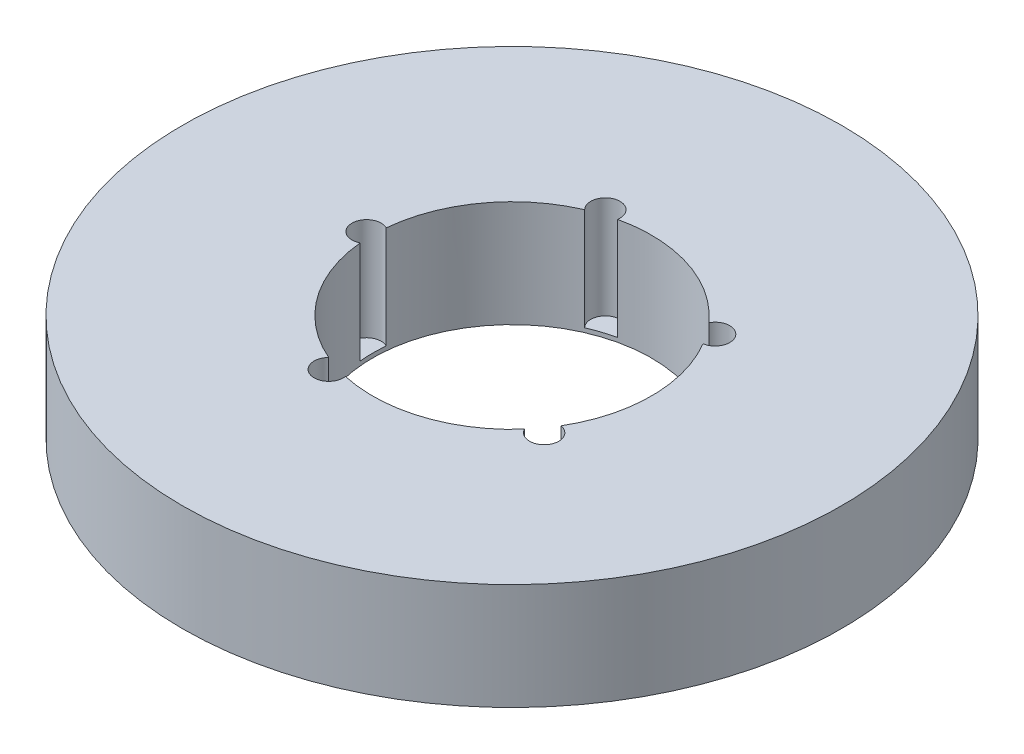
from build123d import *

# Parameters (mm, degrees)
SKETCH1_R           = 65
BOSS_EXTRUDE1_DEPTH = 21
SKETCH2_R           = 27.5
CUT_EXTRUDE1_DEPTH  = 95.292099351
SKETCH3_R           = 2.885315582
CUT_EXTRUDE2_DEPTH  = 20.173790388
CIRPATTERN1_COUNT   = 5


with BuildPart() as part:
    # Sketch1 → Boss-Extrude1 (new body)
    with BuildSketch(Plane(origin=(0, 0, 0), x_dir=(1, 0, 0), z_dir=(0, 1, 0))):
        Circle(SKETCH1_R)
    extrude(amount=BOSS_EXTRUDE1_DEPTH)

    # Sketch2 → Cut-Extrude1 (cut, through all)
    with BuildSketch(Plane(origin=(0, 0, 0), x_dir=(1, 0, 0), z_dir=(0, 1, 0))):
        Circle(SKETCH2_R)
    extrude(amount=CUT_EXTRUDE1_DEPTH, mode=Mode.SUBTRACT)

    # Sketch3 → Cut-Extrude2 (cut)
    with BuildSketch(Plane(origin=(0, 21, 0), x_dir=(1, 0, 0), z_dir=(0, 1, 0))):
        with Locations((-28.684696113, 0)):
            Circle(SKETCH3_R)
    cut_extrude2 = extrude(amount=-CUT_EXTRUDE2_DEPTH, mode=Mode.SUBTRACT)

    # CirPattern1: Cut-Extrude2 ×5 about axis
    cirpattern1_axis = Axis((0, 0, 0), (0, 1, 0))
    for i in range(1, CIRPATTERN1_COUNT):
        add(cut_extrude2.rotate(cirpattern1_axis, i * 360 / CIRPATTERN1_COUNT), mode=Mode.SUBTRACT)


solid = part.part
